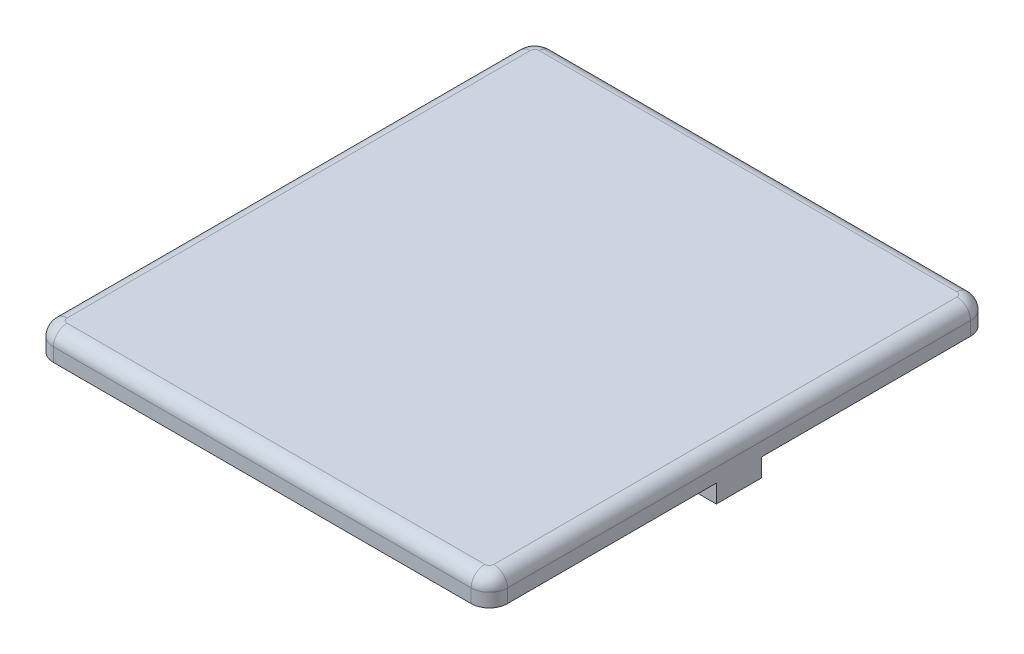
from build123d import *

# Parameters (mm, degrees)
SKETCH1_W             = 50
SKETCH1_H             = 3
SOLARPANET_DEPTH      = 27.5
FILLET1_R             = 2
FILLET2_R             = 1.5
SKETCH2_W             = 50
SKETCH2_H             = 5
BACKSUPPORT_DEPTH     = 2
SKETCH3_R             = 6.5
SKETCH3_R_2           = 5
SUPPORTRING_DEPTH     = 5
HOLE_START            = -5
SKETCH4_R             = 5
HOLE_4_JOYSTICK_DEPTH = 5
FILLET4_R             = 0.5


with BuildPart() as part:
    # Sketch1 → SolarPanet (new, symmetric)
    with BuildSketch(Plane.XY):
        with Locations((25, 1.5)):
            Rectangle(SKETCH1_W, SKETCH1_H)
    extrude(amount=SOLARPANET_DEPTH, both=True)

    # Fillet1
    fillet1_edges = [part.edges().sort_by_distance(p)[0] for p in [
        (50, 1.5, 27.5),
        (0, 1.5, 27.5),
        (50, 1.5, -27.5),
        (0, 1.5, -27.5),
    ]]
    fillet(fillet1_edges, radius=FILLET1_R)

    # Fillet2
    fillet2_edges = [part.edges().sort_by_distance(p)[0] for p in [
        (0, 3, 0),
        (25, 3, -27.5),
        (25, 3, 27.5),
        (50, 3, 0),
        (0.585786438, 3, 26.914213562),
        (49.414213562, 3, 26.914213562),
        (49.414213562, 3, -26.914213562),
        (0.585786438, 3, -26.914213562),
    ]]
    fillet(fillet2_edges, radius=FILLET2_R)

    # Sketch2 → BackSupport (add)
    with BuildSketch(Plane.XZ):
        with Locations((25, 0)):
            Rectangle(SKETCH2_W, SKETCH2_H)
    extrude(amount=BACKSUPPORT_DEPTH)

    # Sketch3 → SupportRing (add)
    with BuildSketch(Plane.XZ):
        with Locations((25, 0)):
            Circle(SKETCH3_R)
        with Locations((25, 0)):
            Circle(SKETCH3_R_2, mode=Mode.SUBTRACT)
    extrude(amount=SUPPORTRING_DEPTH)

    # Sketch4 → Hole 4 Joystick (cut)
    with BuildSketch(Plane.XZ.offset(5).offset(HOLE_START)):
        with Locations((25, 0)):
            Circle(SKETCH4_R)
    extrude(amount=HOLE_4_JOYSTICK_DEPTH, mode=Mode.SUBTRACT)

    # Sketch5 → Round Cut 4 Joystick (revolve, cut)
    with BuildSketch(Plane.XY, mode=Mode.PRIVATE) as round_cut_4_joystick_sk:
        with BuildLine():
            Line((25, -1.64), (30, -1.64))
            ThreePointArc((30, -1.64), (31.43, -3.07), (30, -4.5))
            Line((30, -4.5), (25, -4.5))
            Line((25, -4.5), (25, -1.64))
        make_face()
    revolve(round_cut_4_joystick_sk.sketch.rotate(Axis((25, 10.438378753, 0), (0, -1, 0)), 22.619864948), axis=Axis((25, 10.438378753, 0), (0, -1, 0)), mode=Mode.SUBTRACT)

    # Fillet4
    fillet4_edges = [part.edges().sort_by_distance(p)[0] for p in [
        (20, -5, 0),
        (18.5, -5, 0),
    ]]
    fillet(fillet4_edges, radius=FILLET4_R - 0.0001)  # a hair under: the kernel refuses the full size


solid = part.part
